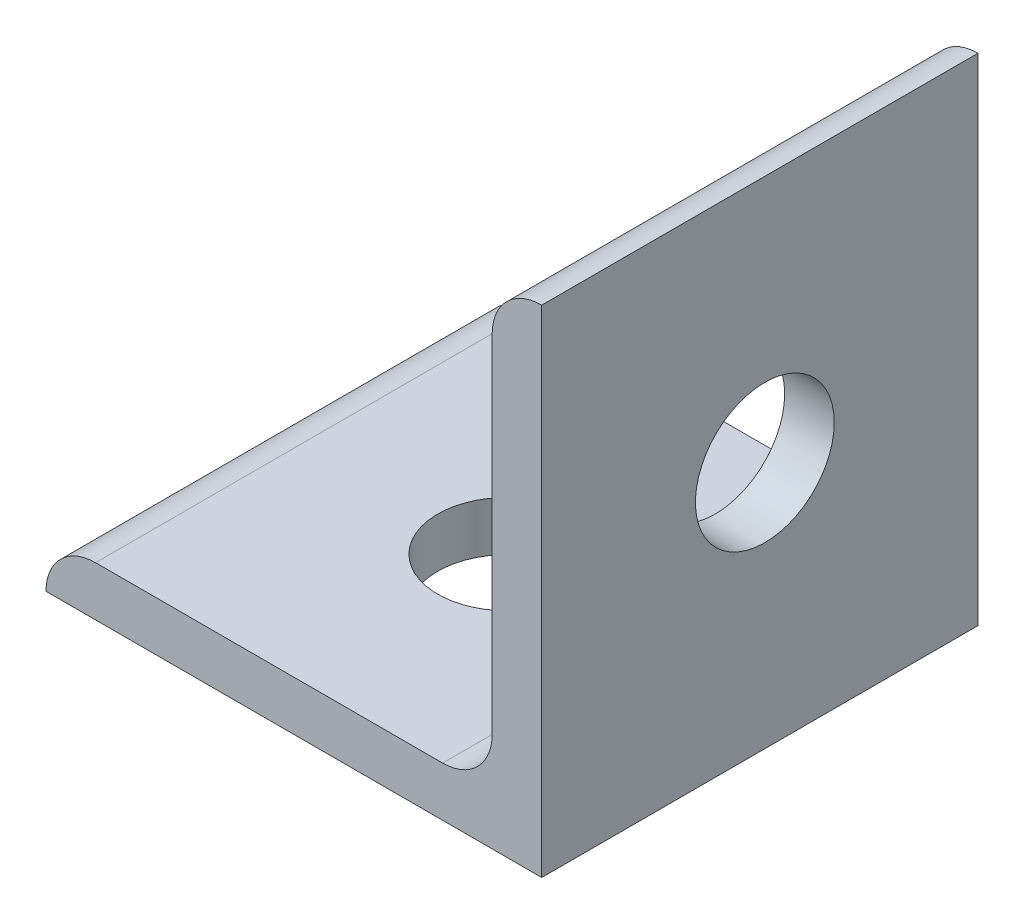
from build123d import *

# Parameters (mm, degrees)
EXTRUDE_THIN1_DEPTH = 22.352
FILLET1_R           = 2.54
SKETCH2_R           = 3.556
CUT_EXTRUDE1_DEPTH  = 2.54
SKETCH3_R           = 3.556
CUT_EXTRUDE2_DEPTH  = 2.54


with BuildPart() as part:
    # Sketch1 → Extrude-Thin1 (new body)
    with BuildSketch(Plane.XY):
        Polygon((-11.43, -11.43), (11.43, -11.43), (11.43, 11.43), (13.97, 11.43), (13.97, -13.97), (-11.43, -13.97), align=None)
    extrude(amount=EXTRUDE_THIN1_DEPTH)

    # Fillet1
    fillet1_edges = [part.edges().sort_by_distance(p)[0] for p in [
        (11.43, 11.43, 11.176),
        (-11.43, -11.43, 11.176),
        (11.43, -11.43, 11.176),
    ]]
    fillet(fillet1_edges, radius=FILLET1_R - 0.0001)  # a hair under: the kernel refuses the full size

    # Sketch2 → Cut-Extrude1 (cut)
    with BuildSketch(Plane.XZ.offset(13.97)):
        with Locations(Location((1.27, 11.43, 0), (0, 0, 270))):
            Circle(SKETCH2_R)
    extrude(amount=-CUT_EXTRUDE1_DEPTH, mode=Mode.SUBTRACT)

    # Sketch3 → Cut-Extrude2 (cut)
    with BuildSketch(Plane(origin=(13.97, 0, 0), x_dir=(0, 0, -1), z_dir=(1, 0, 0))):
        with Locations((-10.922, -1.27)):
            Circle(SKETCH3_R)
    extrude(amount=-CUT_EXTRUDE2_DEPTH, mode=Mode.SUBTRACT)


solid = part.part
